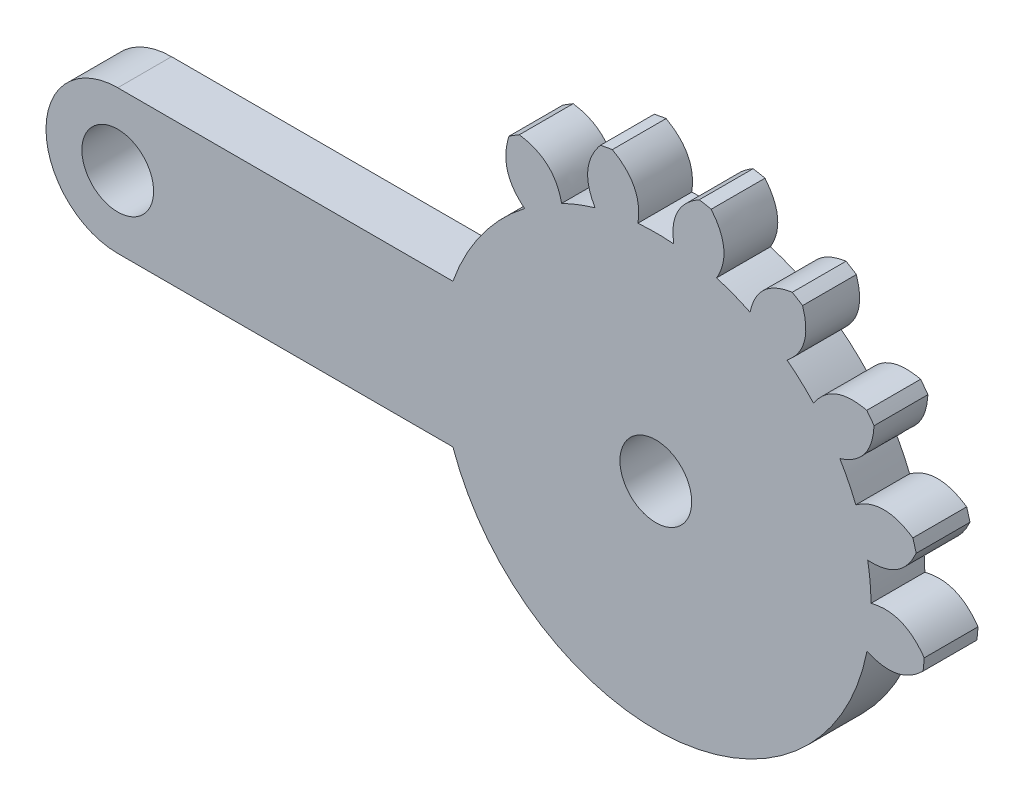
from build123d import *

# Parameters (mm, degrees)
EXTRUDE_1_OUTLINE_R      = 19
EXTRUDE_1_DEPTH          = 3
CUT_EXTRUDE_1_DEPTH      = 28.037011669
CUT_EXTRUDE_START        = -3
SKETCH_5_R               = 19
SKETCH_5_R_2             = 15
CUT_EXTRUDE_2_DEPTH      = 3
PATTERN_CIRCULAR_1_COUNT = 17
CUT_EXTRUDE_4_DEPTH      = 3
EXTRUDE_3_DEPTH          = 3
SKETCH_7_R               = 2
CUT_EXTRUDE_3_DEPTH      = 3


# Read off the part's stored shape, not the designer's step: 凸台-拉伸1
with BuildPart() as part:
    # 凸台-拉伸1 outline → 凸台-拉伸1 (new body)
    with BuildSketch(Plane.XY):
        Circle(EXTRUDE_1_OUTLINE_R)
    extrude(amount=EXTRUDE_1_DEPTH)

    # 草图2 → 切除-拉伸1 (cut, through all)
    with BuildSketch(Plane.XY):
        with BuildLine():
            ThreePointArc((1, 11.958260743), (0, 12), (-1, 11.958260743))
            add(Edge.make_bspline(
                [(-1, 11.958260743), (-0.697871553, 13.823728022), (-2.422759286, 14.803048248)],
                knots=[0, 0, 0, 1, 1, 1], degree=2))
            ThreePointArc((-2.422759286, 14.803048248), (0, 15), (2.422759286, 14.803048248))
            add(Edge.make_bspline(
                [(1, 11.958260743), (0.697871553, 13.823728022), (2.422759286, 14.803048248)],
                knots=[0, 0, 0, 1, 1, 1], degree=2))
        make_face()
    cut_extrude_1 = extrude(amount=CUT_EXTRUDE_1_DEPTH, mode=Mode.SUBTRACT)

    # 草图5 → 切除-拉伸2 (cut)
    with BuildSketch(Plane.XY.offset(3).offset(CUT_EXTRUDE_START)):
        Circle(SKETCH_5_R)
        Circle(SKETCH_5_R_2, mode=Mode.SUBTRACT)
    extrude(amount=CUT_EXTRUDE_2_DEPTH, mode=Mode.SUBTRACT)

    # 阵列(圆周)1: 切除-拉伸1 ×17 about axis
    pattern_circular_1_axis = Axis((0, 0, 3), (0, 0, -1))
    for i in range(1, PATTERN_CIRCULAR_1_COUNT):
        add(cut_extrude_1.rotate(pattern_circular_1_axis, i * 360 / PATTERN_CIRCULAR_1_COUNT), mode=Mode.SUBTRACT)

    # 草图8 → 切除-拉伸4 (cut)
    with BuildSketch(Plane(origin=(0, 0, 0), x_dir=(-1, 0, 0), z_dir=(0, 0, -1))):
        with BuildLine():
            Line((10.120821448, 11.071087264), (8.096657158, 8.856869812))
            ThreePointArc((8.096657158, 8.856869812), (6.278516295, -10.226447728), (-11.561990246, -3.212535065))
            Line((-11.561990246, -3.212535065), (-13.925196787, -5.575741606))
            ThreePointArc((-13.925196787, -5.575741606), (8.538005961, -12.332982373), (10.120821448, 11.071087264))
        make_face()
    extrude(amount=-CUT_EXTRUDE_4_DEPTH, mode=Mode.SUBTRACT)

    # 草图6 → 凸台-拉伸3 (add)
    with BuildSketch(Plane.XY.offset(3)):
        with BuildLine():
            Line((-30, 4), (0, 4))
            Line((0, 4), (0, -4))
            Line((0, -4), (-30, -4))
            ThreePointArc((-30, -4), (-34, 0), (-30, 4))
        make_face()
    extrude(amount=-EXTRUDE_3_DEPTH)

    # 草图7 → 切除-拉伸3 (cut)
    with BuildSketch(Plane(origin=(0, 0, 0), x_dir=(-1, 0, 0), z_dir=(0, 0, -1))):
        Circle(SKETCH_7_R)
        with Locations((30, 0)):
            Circle(SKETCH_7_R)
    extrude(amount=-CUT_EXTRUDE_3_DEPTH, mode=Mode.SUBTRACT)


solid = part.part
